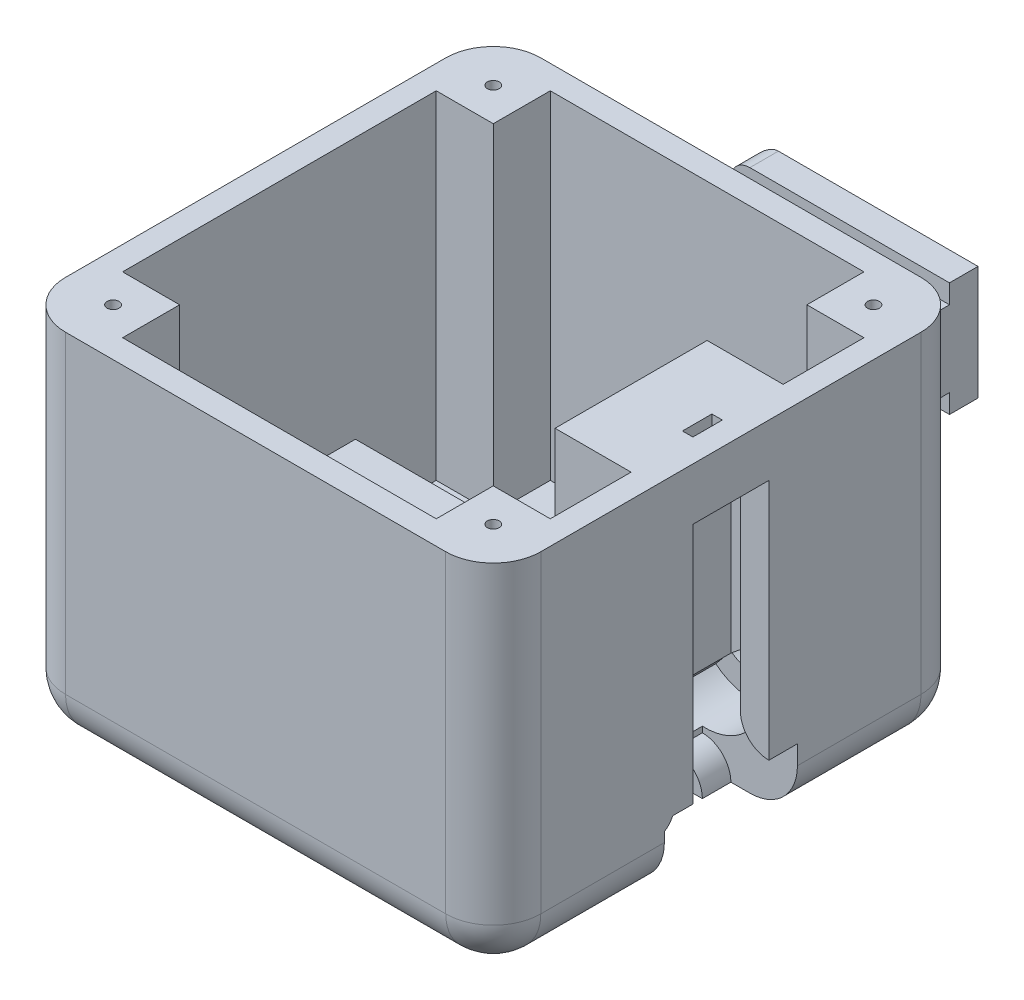
from build123d import *

# Parameters (mm, degrees)
SKETCH1_W                = 50
SKETCH1_H                = 50
BOSS_EXTRUDE1_DEPTH      = 38
SHELL1_T                 = -2.5
BOSS_EXTRUDE2_DEPTH      = 21
SKETCH3_W                = 45
SKETCH3_H                = 16
BOSS_EXTRUDE3_DEPTH      = 8
SKETCH4_W                = 32.5
SKETCH4_H                = 8
CUT_EXTRUDE1_DEPTH       = 3
SKETCH7_W                = 32.5
SKETCH7_H                = 12
CUT_EXTRUDE2_DEPTH       = 3
SKETCH8_W                = 16
SKETCH8_H                = 27.5
BOSS_EXTRUDE4_DEPTH      = 8
SKETCH9_W                = 8
SKETCH9_H                = 32.5
CUT_EXTRUDE3_DEPTH       = 3
CUT_EXTRUDE5_DEPTH       = 3
CUT_EXTRUDE7_DEPTH       = 10
CUT_EXTRUDE7_DEPTH_BACK  = 2
SKETCH13_W               = 3
SKETCH13_H               = 3.011524732
FILLET1_R                = 5
SKETCH16_R               = 1.8
CUT_EXTRUDE8_DEPTH       = 53.642663306
SKETCH17_W               = 23
SKETCH17_H               = 12
BOSS_EXTRUDE5_DEPTH      = 6
SKETCH18_W               = 3
SKETCH18_H               = 2
CUT_EXTRUDE9_DEPTH       = 57.471231614
CUT_EXTRUDE12_DEPTH      = 2
CUT_EXTRUDE13_DEPTH      = 2
CUT_EXTRUDE14_DEPTH      = 16
CUT_EXTRUDE10_START      = -19.5
CUT_EXTRUDE10_DEPTH      = 19.5
FILLET4_R                = 2
CUT_EXTRUDE18_DEPTH      = 13
CUT_EXTRUDE18_DEPTH_BACK = 1
SKETCH26_W               = 6
SKETCH26_H               = 6
BOSS_EXTRUDE6_DEPTH      = 4.5
SKETCH30_W               = 4.34
SKETCH30_H               = 1.8
CUT_EXTRUDE19_DEPTH      = 4.4
SKETCH31_W               = 1.8
SKETCH31_H               = 4.34
CUT_EXTRUDE20_DEPTH      = 4.4
SKETCH32_W               = 1.1
SKETCH32_H               = 3.1
CUT_EXTRUDE21_DEPTH      = 55.291896265
SKETCH33_W               = 3.1
SKETCH33_H               = 1.1
CUT_EXTRUDE22_DEPTH      = 3.55
SKETCH34_W               = 2
SKETCH34_H               = 3.1
CUT_EXTRUDE23_DEPTH      = 7.3
SKETCH45_R               = 3.575
CUT_EXTRUDE27_DEPTH      = 20
SKETCH46_W               = 1.850257739
SKETCH46_H               = 4
SKETCH46_W_2             = 4
SKETCH46_H_2             = 1.850257739
CUT_EXTRUDE28_DEPTH      = 1
CUT_EXTRUDE25_START      = -3
CUT_EXTRUDE25_DEPTH      = 3
CUT_EXTRUDE24_START      = -3
CUT_EXTRUDE24_DEPTH      = 3
CUT_EXTRUDE29_DEPTH      = 2
FILLET8_R                = 2
BOSS_EXTRUDE9_DEPTH      = 8.78
SKETCH49_W               = 4.2
SKETCH49_H               = 13
BOSS_EXTRUDE10_DEPTH     = 6.5
SKETCH50_W               = 6
SKETCH50_H               = 6
BOSS_EXTRUDE11_DEPTH     = 35.5
M1_6_TAPPED_HOLE1_D      = 1.25
M1_6_TAPPED_HOLE1_DEPTH  = 5
M1_6_TAPPED_HOLE1_TIP    = 0.375537887


with BuildPart() as part:
    # Sketch1 → Boss-Extrude1 (new body)
    with BuildSketch(Plane(origin=(0, 0, 0), x_dir=(1, 0, 0), z_dir=(0, 1, 0))):
        Rectangle(SKETCH1_W, SKETCH1_H)
    extrude(amount=BOSS_EXTRUDE1_DEPTH)

    # Shell1
    shell1_openings = [part.faces().sort_by_distance(p)[0] for p in [
        (0, 38, 0),
    ]]
    offset(amount=SHELL1_T, openings=shell1_openings, kind=Kind.INTERSECTION)

    # Sketch2 → Boss-Extrude2 (add)
    with BuildSketch(Plane(origin=(0, 2.5, 0), x_dir=(1, 0, 0), z_dir=(0, 1, 0))):
        Polygon((10.3, 22.5), (10.3, 13.5), (10.3, 7.28), (22.5, 7.28), (22.5, 22.5), align=None)
    extrude(amount=BOSS_EXTRUDE2_DEPTH)

    # Sketch3 → Boss-Extrude3 (add)
    with BuildSketch(Plane(origin=(0, 2.5, 0), x_dir=(1, 0, 0), z_dir=(0, 1, 0))):
        Rectangle(SKETCH3_W, SKETCH3_H)
    extrude(amount=BOSS_EXTRUDE3_DEPTH)

    # Sketch4 → Cut-Extrude1 (cut)
    with BuildSketch(Plane.XZ):
        with Locations((8.75, 0)):
            Rectangle(SKETCH4_W, SKETCH4_H)
    extrude(amount=-CUT_EXTRUDE1_DEPTH, mode=Mode.SUBTRACT)

    # Sketch7 → Cut-Extrude2 (cut)
    with BuildSketch(Plane(origin=(0, 3, 0), x_dir=(-1, 0, 0), z_dir=(0, -1, 0))):
        with Locations((-8.75, 0)):
            Rectangle(SKETCH7_W, SKETCH7_H)
    extrude(amount=-CUT_EXTRUDE2_DEPTH, mode=Mode.SUBTRACT)

    # Sketch8 → Boss-Extrude4 (add)
    with BuildSketch(Plane.ZY.offset(-22.5)):
        with Locations((0, 24.25)):
            Rectangle(SKETCH8_W, SKETCH8_H)
    extrude(amount=BOSS_EXTRUDE4_DEPTH)

    # Sketch9 → Cut-Extrude3 (cut)
    with BuildSketch(Plane(origin=(25, 0, 0), x_dir=(0, 0, -1), z_dir=(1, 0, 0))):
        with Locations((0, 16.25)):
            Rectangle(SKETCH9_W, SKETCH9_H)
    extrude(amount=-CUT_EXTRUDE3_DEPTH, mode=Mode.SUBTRACT)

    # Sketch10 → Cut-Extrude5 (cut)
    with BuildSketch(Plane(origin=(22, 0, 0), x_dir=(0, 0, -1), z_dir=(1, 0, 0))):
        Polygon((-6, 32.5), (-6, 0), (6, 0), (6, 3), (6, 32.5), align=None)
    extrude(amount=-CUT_EXTRUDE5_DEPTH, mode=Mode.SUBTRACT)

    # Sketch13 → Cut-Extrude7 (cut, two sides: drawn at the far end of the back side and taken through both)
    with BuildSketch(Plane(origin=(0, 0, 4), x_dir=(-1, 0, 0), z_dir=(0, 0, -1)).offset(-CUT_EXTRUDE7_DEPTH_BACK)):
        with Locations((-23.5, 1.505762366)):
            Rectangle(SKETCH13_W, SKETCH13_H)
    extrude(amount=CUT_EXTRUDE7_DEPTH + CUT_EXTRUDE7_DEPTH_BACK, mode=Mode.SUBTRACT)

    # Fillet1
    fillet1_edges = [part.edges().sort_by_distance(p)[0] for p in [
        (25, 0, -15.5),
        (0, 0, -25),
        (25, 0, 15.5),
        (0, 0, 25),
        (-25, 0, 0),
        (-25, 19, -25),
        (25, 19, -25),
        (25, 19, 25),
        (-25, 19, 25),
    ]]
    fillet(fillet1_edges, radius=FILLET1_R)

    # Sketch16 → Cut-Extrude8 (cut, through all)
    with BuildSketch(Plane(origin=(0, 0, 1.5), x_dir=(-1, 0, 0), z_dir=(0, 0, -1))):
        with Locations(Location((-15.3, 9.7, 0), (0, 0, 63.612200039))):
            Circle(SKETCH16_R)
    extrude(amount=CUT_EXTRUDE8_DEPTH, mode=Mode.SUBTRACT)

    # Sketch17 → Boss-Extrude5 (add)
    with BuildSketch(Plane(origin=(0, 0, -25), x_dir=(-1, 0, 0), z_dir=(0, 0, -1))):
        with Locations((-8.5, 30)):
            Rectangle(SKETCH17_W, SKETCH17_H)
    extrude(amount=BOSS_EXTRUDE5_DEPTH)

    # Sketch18 → Cut-Extrude9 (cut, through all)
    with BuildSketch(Plane.ZY.offset(3)):
        with Locations((-26.5, 25)):
            Rectangle(SKETCH18_W, SKETCH18_H)
        with Locations((-26.5, 35)):
            Rectangle(SKETCH18_W, SKETCH18_H)
    extrude(amount=-CUT_EXTRUDE9_DEPTH, mode=Mode.SUBTRACT)

    # Sketch20 → Cut-Extrude12 (cut)
    with BuildSketch(Plane(origin=(0, 0, 4), x_dir=(-1, 0, 0), z_dir=(0, 0, -1))):
        with BuildLine():
            Line((-22, 10), (-22, 7))
            Line((-22, 7), (-22, 6))
            Line((-22, 6), (-24, 6))
            Line((-24, 6), (-25, 6))
            Line((-25, 6), (-25, 7))
            ThreePointArc((-25, 7), (-22.878679656, 7.878679656), (-22, 10))
        make_face()
    extrude(amount=-CUT_EXTRUDE12_DEPTH, mode=Mode.SUBTRACT)

    # Sketch21 → Cut-Extrude13 (cut)
    with BuildSketch(Plane(origin=(0, 0, 4), x_dir=(-1, 0, 0), z_dir=(0, 0, -1))):
        with BuildLine():
            Line((-19, 3), (-19, 0))
            Line((-19, 0), (-18, 0))
            ThreePointArc((-18, 0), (-17.121320344, 2.121320344), (-15, 3))
            Line((-15, 3), (-19, 3))
        make_face()
    extrude(amount=-CUT_EXTRUDE13_DEPTH, mode=Mode.SUBTRACT)

    # Sketch22 → Cut-Extrude14 (cut)
    with BuildSketch(Plane(origin=(0, 0, 4), x_dir=(-1, 0, 0), z_dir=(0, 0, -1))):
        with BuildLine():
            Line((-15.3, 9.7), (-11.411555581, 5))
            ThreePointArc((-11.411555581, 5), (-19.613351365, 5.386648635), (-20, 13.588444419))
            Line((-20, 13.588444419), (-15.3, 9.7))
        make_face()
    extrude(amount=CUT_EXTRUDE14_DEPTH, mode=Mode.SUBTRACT)

    # Sketch19 → Cut-Extrude10 (cut)
    with BuildSketch(Plane(origin=(0, 0, -25), x_dir=(-1, 0, 0), z_dir=(0, 0, -1)).offset(CUT_EXTRUDE10_START)):
        with BuildLine():
            ThreePointArc((-16.123011235, 8.099171306), (-16.572792206, 8.427207794), (-16.900828694, 8.876988765))
            Line((-16.900828694, 8.876988765), (-17.43115878, 8.346658679))
            Line((-17.43115878, 8.346658679), (-16.653341321, 7.56884122))
            Line((-16.653341321, 7.56884122), (-16.123011235, 8.099171306))
        make_face()
        with BuildLine():
            ThreePointArc((-14.476988765, 11.300828694), (-14.027207794, 10.972792206), (-13.699171306, 10.523011235))
            Line((-13.699171306, 10.523011235), (-13.16884122, 11.053341321))
            Line((-13.16884122, 11.053341321), (-13.946658679, 11.83115878))
            Line((-13.946658679, 11.83115878), (-14.476988765, 11.300828694))
        make_face()
    extrude(amount=CUT_EXTRUDE10_DEPTH, mode=Mode.SUBTRACT)

    # Fillet4
    fillet4_edges = [part.edges().sort_by_distance(p)[0] for p in [
        (-3, 36, -29.5),
        (-3, 24, -29.5),
        (-3, 30, -31),
    ]]
    fillet(fillet4_edges, radius=FILLET4_R)

    # Sketch26 → Cut-Extrude18 (cut, two sides: drawn at the far end of the back side and taken through both)
    with BuildSketch(Plane(origin=(0, 0, 6), x_dir=(-1, 0, 0), z_dir=(0, 0, -1)).offset(-CUT_EXTRUDE18_DEPTH_BACK)):
        with Locations((-22, 3)):
            Rectangle(SKETCH26_W, SKETCH26_H)
    extrude(amount=CUT_EXTRUDE18_DEPTH + CUT_EXTRUDE18_DEPTH_BACK, mode=Mode.SUBTRACT)

    # Sketch29 → Boss-Extrude6 (add)
    with BuildSketch(Plane(origin=(0, 0, 6), x_dir=(-1, 0, 0), z_dir=(0, 0, -1))):
        with BuildLine():
            Line((-16.499079266, 10.69203257), (-15.305377807, 9.639286837))
            Line((-15.305377807, 9.639286837), (-14.258167132, 8.440726637))
            ThreePointArc((-14.258167132, 8.440726637), (-14.177344347, 10.762112408), (-16.499079266, 10.69203257))
        make_face()
    extrude(amount=BOSS_EXTRUDE6_DEPTH)

    # Sketch30 → Cut-Extrude19 (cut)
    with BuildSketch(Plane(origin=(-7.5, 0, 0), x_dir=(0, 0, -1), z_dir=(1, 0, 0))):
        with Locations((0, 3)):
            Rectangle(SKETCH30_W, SKETCH30_H)
    extrude(amount=-CUT_EXTRUDE19_DEPTH, mode=Mode.SUBTRACT)

    # Sketch31 → Cut-Extrude20 (cut)
    with BuildSketch(Plane.XZ.offset(-32.5)):
        with Locations((22, 0)):
            Rectangle(SKETCH31_W, SKETCH31_H)
    extrude(amount=-CUT_EXTRUDE20_DEPTH, mode=Mode.SUBTRACT)

    # Sketch32 → Cut-Extrude21 (cut, through all)
    with BuildSketch(Plane.XZ.offset(-36.9)):
        with Locations((22, 0)):
            Rectangle(SKETCH32_W, SKETCH32_H)
    extrude(amount=-CUT_EXTRUDE21_DEPTH, mode=Mode.SUBTRACT)

    # Sketch33 → Cut-Extrude22 (cut)
    with BuildSketch(Plane(origin=(-11.9, 0, 0), x_dir=(0, 0, -1), z_dir=(1, 0, 0))):
        with Locations((0, 3)):
            Rectangle(SKETCH33_W, SKETCH33_H)
    extrude(amount=-CUT_EXTRUDE22_DEPTH, mode=Mode.SUBTRACT)

    # Sketch34 → Cut-Extrude23 (cut)
    with BuildSketch(Plane(origin=(0, 10.5, 0), x_dir=(1, 0, 0), z_dir=(0, 1, 0))):
        with Locations((-14.45, 0)):
            Rectangle(SKETCH34_W, SKETCH34_H)
    extrude(amount=-CUT_EXTRUDE23_DEPTH, mode=Mode.SUBTRACT)

    # Sketch45 → Cut-Extrude27 (cut)
    with BuildSketch(Plane(origin=(0, 0, 1.5), x_dir=(-1, 0, 0), z_dir=(0, 0, -1))):
        with Locations(Location((-15.3, 9.7, 0), (0, 0, 140.398072919))):
            Circle(SKETCH45_R)
    extrude(amount=CUT_EXTRUDE27_DEPTH, mode=Mode.SUBTRACT)

    # Sketch46 → Cut-Extrude28 (cut)
    with BuildSketch(Plane.XY.offset(-6)):
        with Locations((21.074871131, 8)):
            Rectangle(SKETCH46_W, SKETCH46_H)
        with Locations((17, 3.925128869)):
            Rectangle(SKETCH46_W_2, SKETCH46_H_2)
    extrude(amount=-CUT_EXTRUDE28_DEPTH, mode=Mode.SUBTRACT)

    # Sketch43 → Cut-Extrude25 (cut)
    with BuildSketch(Plane.XY.offset(-4).offset(CUT_EXTRUDE25_START)):
        with BuildLine():
            Line((19, 0), (18, 0))
            ThreePointArc((18, 0), (17.121320344, 2.121320344), (15, 3))
            Line((15, 3), (19, 3))
            Line((19, 3), (19, 0))
        make_face()
    extrude(amount=CUT_EXTRUDE25_DEPTH, mode=Mode.SUBTRACT)

    # Sketch42 → Cut-Extrude24 (cut)
    with BuildSketch(Plane.XY.offset(-4).offset(CUT_EXTRUDE24_START)):
        with BuildLine():
            Line((22, 6), (25, 6))
            Line((25, 6), (25, 7))
            ThreePointArc((25, 7), (22.878679656, 7.878679656), (22, 10))
            Line((22, 10), (22, 6))
        make_face()
    extrude(amount=CUT_EXTRUDE24_DEPTH, mode=Mode.SUBTRACT)

    # Sketch47 → Cut-Extrude29 (cut)
    with BuildSketch(Plane(origin=(0, 0, 4), x_dir=(-1, 0, 0), z_dir=(0, 0, -1))):
        Polygon((-19, 12.761115819), (-16.499079266, 10.69203257), (-15.305377807, 9.639286837), (-14.258167132, 8.440726637), (-12.238884181, 6), (-19, 6), align=None)
    extrude(amount=-CUT_EXTRUDE29_DEPTH, mode=Mode.SUBTRACT)

    # Fillet8
    # the kernel refuses this fillet: 2 mm, written as the material it takes off along each edge
    with BuildSketch(Plane(origin=(19, 6, 6), x_dir=(-1, 0, 0), z_dir=(0, -1, 0))) as fillet8_piece_1_section:
        with BuildLine():
            CenterArc((1.732050808, -2), FILLET8_R, 90, 60)
            Line((0, -1), (0, 0))
            Line((0, 0), (1.732050808, 0))
        make_face()
    fillet8_piece_1 = extrude(amount=10.330127019, mode=Mode.PRIVATE)
    fillet8_piece_1 = fillet8_piece_1 - Plane(origin=(15, 0, 6), x_dir=(1, 0, 0), z_dir=(0, 0, -1)) * Cylinder(3, 28, mode=Mode.PRIVATE)
    add(fillet8_piece_1, mode=Mode.SUBTRACT)
    with BuildSketch(Plane(origin=(29.330127019, 6, 6), x_dir=(0, 1, 0), z_dir=(-1, 0, 0))) as fillet8_piece_2_section:
        with BuildLine():
            CenterArc((1.732050808, -2), FILLET8_R, 90, 60)
            Line((0, -1), (0, 0))
            Line((0, 0), (1.732050808, 0))
        make_face()
    fillet8_piece_2 = extrude(amount=10.330127019, mode=Mode.PRIVATE)
    fillet8_piece_2 = fillet8_piece_2 - Plane(origin=(25, 10, 6), x_dir=(0, -1, 0), z_dir=(0, 0, -1)) * Cylinder(3, 28, mode=Mode.PRIVATE)
    add(fillet8_piece_2, mode=Mode.SUBTRACT)
    with BuildSketch(Plane(origin=(25, 6, 6), x_dir=(0, 1, 0), z_dir=(-1, 0, 0))) as fillet8_piece_3a_section:
        with BuildLine():
            CenterArc((1.732050808, -2), FILLET8_R, 90, 60)
            Line((0, -1), (0, 0))
            Line((0, 0), (1.732050808, 0))
        make_face()
    fillet8_piece_3a = extrude(amount=10.330127019, mode=Mode.PRIVATE)
    fillet8_piece_3a = split(fillet8_piece_3a, bisect_by=Plane(origin=(19, 6, 6), z_dir=(-1, 0, 0)), keep=Keep.TOP, mode=Mode.PRIVATE)
    with BuildSketch(Plane(origin=(19, 10.330127019, 6), x_dir=(-1, 0, 0), z_dir=(0, -1, 0))) as fillet8_piece_3b_section:
        with BuildLine():
            CenterArc((1.732050808, -2), FILLET8_R, 90, 60)
            Line((0, -1), (0, 0))
            Line((0, 0), (1.732050808, 0))
        make_face()
    fillet8_piece_3b = extrude(amount=10.330127019, mode=Mode.PRIVATE)
    fillet8_piece_3b = split(fillet8_piece_3b, bisect_by=Plane(origin=(19, 6, 6), z_dir=(0, 1, 0)), keep=Keep.TOP, mode=Mode.PRIVATE)
    fillet8_piece_3 = fillet8_piece_3a & fillet8_piece_3b
    add(fillet8_piece_3, mode=Mode.SUBTRACT)

    # Sketch48 → Boss-Extrude9 (add)
    with BuildSketch(Plane.XY.offset(-7.28)):
        with BuildLine():
            Line((10.3, 10.5), (10.3, 23.5))
            Line((10.3, 23.5), (14.5, 23.5))
            Line((14.5, 23.5), (14.5, 13.184339966))
            ThreePointArc((14.5, 13.184339966), (12.8103313, 12.1896687), (11.815660034, 10.5))
            Line((11.815660034, 10.5), (10.3, 10.5))
        make_face()
    extrude(amount=BOSS_EXTRUDE9_DEPTH)

    # Sketch49 → Boss-Extrude10 (add)
    with BuildSketch(Plane.XY.offset(1.5)):
        with Locations((12.4, 17)):
            Rectangle(SKETCH49_W, SKETCH49_H)
    extrude(amount=BOSS_EXTRUDE10_DEPTH)

    # Sketch50 → Boss-Extrude11 (add)
    with BuildSketch(Plane(origin=(0, 2.5, 0), x_dir=(1, 0, 0), z_dir=(0, 1, 0))):
        with Locations((-19.5, 19.5)):
            Rectangle(SKETCH50_W, SKETCH50_H)
        with Locations((-19.5, -19.5)):
            Rectangle(SKETCH50_W, SKETCH50_H)
        with Locations((19.5, 19.5)):
            Rectangle(SKETCH50_W, SKETCH50_H)
        with Locations((19.5, -19.5)):
            Rectangle(SKETCH50_W, SKETCH50_H)
    extrude(amount=BOSS_EXTRUDE11_DEPTH)

    # M1.6 Tapped Hole1
    with Locations(Plane(origin=(0, 38, 0), x_dir=(1, 0, 0), z_dir=(0, 1, 0))):
        with Locations((-20, -20), (-20, 20), (20, 20), (20, -20)):
            Hole(M1_6_TAPPED_HOLE1_D / 2, depth=M1_6_TAPPED_HOLE1_DEPTH)
            with Locations((0, 0, -(M1_6_TAPPED_HOLE1_DEPTH + M1_6_TAPPED_HOLE1_TIP / 2))):  # 118° drill point
                Cone(0, M1_6_TAPPED_HOLE1_D / 2, M1_6_TAPPED_HOLE1_TIP, mode=Mode.SUBTRACT)


solid = part.part
